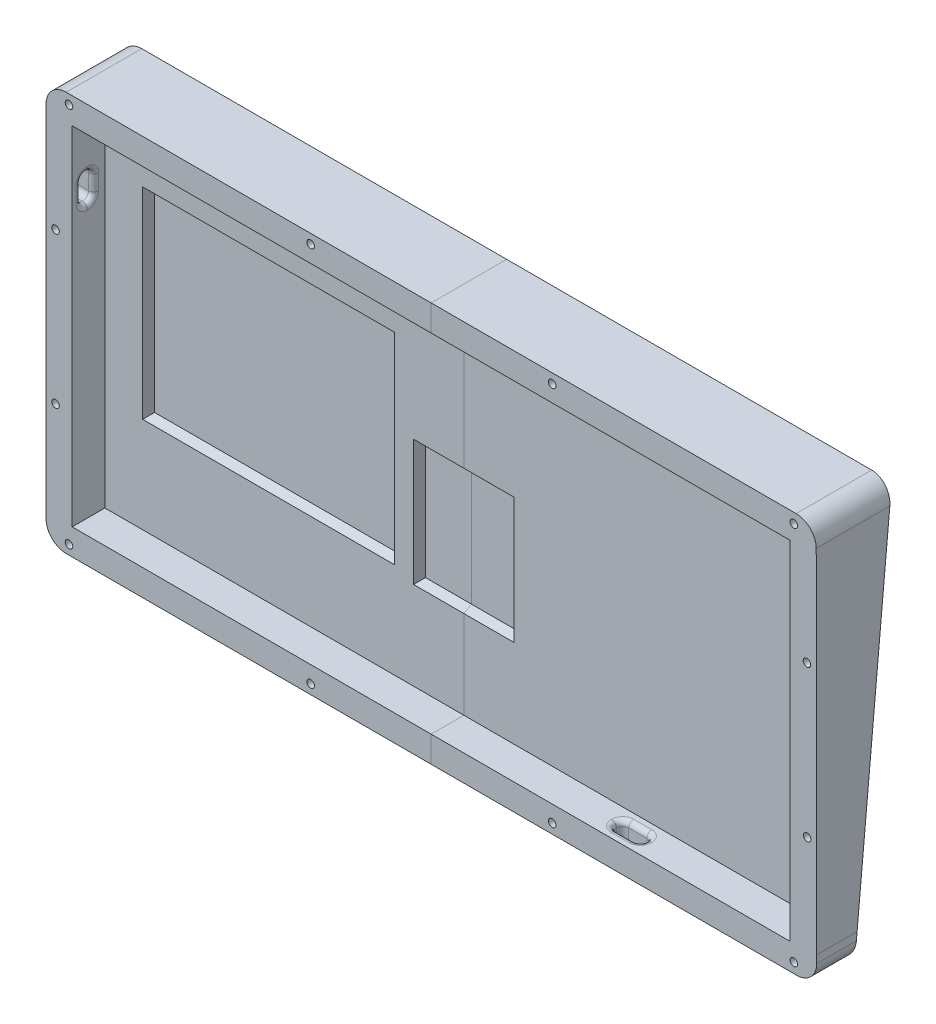
from build123d import *

# Parameters (mm, degrees)
EXTRUDE_1_DEPTH      = 30
SKETCH_2_R           = 1.5
CUT_EXTRUDE_1_DEPTH  = 5
CUT_EXTRUDE_4_DEPTH  = 307
SKETCH_3_W           = 285.26
SKETCH_3_H           = 138.01
CUT_EXTRUDE_5_DEPTH  = 13
SKETCH_12_W          = 40
SKETCH_12_H          = 50
CUT_EXTRUDE_7_DEPTH  = 3
CUT_EXTRUDE_7_DRAFT  = -30
SKETCH_9_W           = 100
SKETCH_9_H           = 80
CUT_EXTRUDE_8_DEPTH  = 3
CUT_EXTRUDE_8_DRAFT  = -30
CUT_EXTRUDE_9_DEPTH  = 11
FILLET_1_R           = 2
CUT_EXTRUDE_10_DEPTH = 11
FILLET_2_R           = 2
FILLET_3_R           = 2
FILLET_4_R           = 2


with BuildPart() as part:
    # Model → 凸台-拉伸1 (new body)
    with BuildSketch(Plane.XY):
        with BuildLine():
            Line((0, 11), (0, 150.75))
            ThreePointArc((0, 150.75), (2.343145751, 156.406854249), (8, 158.75))
            Line((8, 158.75), (298.011203897, 158.75))
            ThreePointArc((298.011203897, 158.75), (303.664092807, 156.410816811), (306.011196041, 150.761211743))
            Line((306.011196041, 150.761211743), (306.207051361, 11.011211743))
            Line((306.207051361, 11.011211743), (306.207051361, 8))
            ThreePointArc((306.207051361, 8), (303.863905611, 2.343145751), (298.207051361, 0))
            Line((298.207051361, 0), (8, 0))
            ThreePointArc((8, 0), (2.343145751, 2.343145751), (0, 8))
            Line((0, 8), (0, 11))
        make_face()
    extrude(amount=-EXTRUDE_1_DEPTH)

    # 草图2 → 切除-拉伸1 (cut)
    with BuildSketch(Plane.XY):
        with Locations((105.108569936, 3.75)):
            Circle(SKETCH_2_R)
        with Locations((9.108569936, 3.75)):
            Circle(SKETCH_2_R)
        with Locations((201.10846029, 3.817270412)):
            Circle(SKETCH_2_R)
        with Locations((297.108366012, 3.951811323)):
            Circle(SKETCH_2_R)
        with Locations((105.108569936, 155)):
            Circle(SKETCH_2_R)
        with Locations((9.108569936, 155)):
            Circle(SKETCH_2_R)
        with Locations((201.10846029, 154.932729588)):
            Circle(SKETCH_2_R)
        with Locations((297.108366012, 154.798188677)):
            Circle(SKETCH_2_R)
        with Locations((3.75, 109.375)):
            Circle(SKETCH_2_R)
        with Locations((3.75, 49.375)):
            Circle(SKETCH_2_R)
        with Locations((302.318900647, 109.584217456)):
            Circle(SKETCH_2_R)
        with Locations((302.402988717, 49.58427638)):
            Circle(SKETCH_2_R)
    extrude(amount=-CUT_EXTRUDE_1_DEPTH, mode=Mode.SUBTRACT)

    # 草图6 → 切除-拉伸4 (cut)
    with BuildSketch(Plane.ZY):
        Polygon((-30, 158.75), (-30, 0), (-15, 0), align=None)
    extrude(amount=-CUT_EXTRUDE_4_DEPTH, mode=Mode.SUBTRACT)

    # 草图3 → 切除-拉伸5 (cut)
    with BuildSketch(Plane.XY):
        with Locations((153, 79.375)):
            Rectangle(SKETCH_3_W, SKETCH_3_H)
    extrude(amount=-CUT_EXTRUDE_5_DEPTH, mode=Mode.SUBTRACT)


with BuildPart() as cut_extrude_7_tool:
    # 草图12 → 切除-拉伸7 (with draft: the straight prism first)
    with BuildSketch(Plane.XY.offset(-13)):
        with Locations((153, 70.37)):
            Rectangle(SKETCH_12_W, SKETCH_12_H)
    extrude(amount=-CUT_EXTRUDE_7_DEPTH)
    # 切除-拉伸7: the draft: its side faces are tilted about the plane it starts from
    cut_extrude_7_sides = [cut_extrude_7_tool.faces().sort_by_distance(p)[0] for p in [
        (153, 45.37, -14.5),
        (173, 70.37, -14.5),
        (153, 95.37, -14.5),
        (133, 70.37, -14.5),
    ]]
    draft(cut_extrude_7_sides, Plane.XY.offset(-13), CUT_EXTRUDE_7_DRAFT)


with BuildPart() as part_1:
    add(part.part)

    # 切除-拉伸7: cut by cut_extrude_7_tool
    add(cut_extrude_7_tool.part, mode=Mode.SUBTRACT)


with BuildPart() as cut_extrude_8_tool:
    # 草图9 → 切除-拉伸8 (with draft: the straight prism first)
    with BuildSketch(Plane.XY.offset(-13)):
        with Locations((75.37, 88.38)):
            Rectangle(SKETCH_9_W, SKETCH_9_H)
    extrude(amount=-CUT_EXTRUDE_8_DEPTH)
    # 切除-拉伸8: the draft: its side faces are tilted about the plane it starts from
    cut_extrude_8_sides = [cut_extrude_8_tool.faces().sort_by_distance(p)[0] for p in [
        (25.37, 88.38, -14.5),
        (75.37, 48.38, -14.5),
        (125.37, 88.38, -14.5),
        (75.37, 128.38, -14.5),
    ]]
    draft(cut_extrude_8_sides, Plane.XY.offset(-13), CUT_EXTRUDE_8_DRAFT)


with BuildPart() as part_2:
    add(part_1.part)

    # 切除-拉伸8: cut by cut_extrude_8_tool
    add(cut_extrude_8_tool.part, mode=Mode.SUBTRACT)

    # 草图14 → 切除-拉伸9 (cut)
    with BuildSketch(Plane.ZY):
        with BuildLine():
            Line((-5.9, 129.38), (-6.1, 129.38))
            ThreePointArc((-6.1, 129.38), (-7.797056275, 128.677056275), (-8.5, 126.98))
            Line((-8.5, 126.98), (-8.5, 120.78))
            ThreePointArc((-8.5, 120.78), (-7.797056275, 119.082943725), (-6.1, 118.38))
            Line((-6.1, 118.38), (-5.9, 118.38))
            ThreePointArc((-5.9, 118.38), (-4.202943725, 119.082943725), (-3.5, 120.78))
            Line((-3.5, 120.78), (-3.5, 126.98))
            ThreePointArc((-3.5, 126.98), (-4.202943725, 128.677056275), (-5.9, 129.38))
        make_face()
    extrude(amount=-CUT_EXTRUDE_9_DEPTH, mode=Mode.SUBTRACT)

    # 圆角1
    fillet_1_edges = [part_2.edges().sort_by_distance(p)[0] for p in [
        (0, 128.677056275, -7.797056275),
        (0, 129.38, -6),
        (0, 128.677056275, -4.202943725),
        (0, 123.88, -3.5),
        (0, 119.082943725, -4.202943725),
        (0, 118.38, -6),
        (0, 119.082943725, -7.797056275),
        (0, 123.88, -8.5),
    ]]
    fillet(fillet_1_edges, radius=FILLET_1_R)

    # 草图15 → 切除-拉伸10 (cut)
    with BuildSketch(Plane.XZ):
        with BuildLine():
            Line((222.53, -3.959687417), (229.73, -3.959687417))
            ThreePointArc((229.73, -3.959687417), (231.427056275, -4.662631142), (232.13, -6.359687417))
            Line((232.13, -6.359687417), (232.13, -6.559687417))
            ThreePointArc((232.13, -6.559687417), (231.427056275, -8.256743692), (229.73, -8.959687417))
            Line((229.73, -8.959687417), (222.53, -8.959687417))
            ThreePointArc((222.53, -8.959687417), (220.832943725, -8.256743692), (220.13, -6.559687417))
            Line((220.13, -6.559687417), (220.13, -6.359687417))
            ThreePointArc((220.13, -6.359687417), (220.832943725, -4.662631142), (222.53, -3.959687417))
        make_face()
    extrude(amount=-CUT_EXTRUDE_10_DEPTH, mode=Mode.SUBTRACT)

    # 圆角2
    fillet_2_edges = [part_2.edges().sort_by_distance(p)[0] for p in [
        (232.13, 0, -6.459687417),
        (231.427056275, 0, -4.662631142),
        (226.13, 0, -3.959687417),
        (220.832943725, 0, -4.662631142),
        (220.13, 0, -6.459687417),
        (220.832943725, 0, -8.256743692),
        (226.13, 0, -8.959687417),
        (231.427056275, 0, -8.256743692),
    ]]
    fillet(fillet_2_edges, radius=FILLET_2_R)

    # 圆角3
    fillet_3_edges = [part_2.edges().sort_by_distance(p)[0] for p in [
        (10.37, 129.38, -6),
        (10.37, 128.677056275, -4.202943725),
        (10.37, 123.88, -3.5),
        (10.37, 119.082943725, -4.202943725),
        (10.37, 118.38, -6),
        (10.37, 119.082943725, -7.797056275),
        (10.37, 123.88, -8.5),
        (10.37, 128.677056275, -7.797056275),
    ]]
    fillet(fillet_3_edges, radius=FILLET_3_R)

    # 圆角4
    fillet_4_edges = [part_2.edges().sort_by_distance(p)[0] for p in [
        (231.427056275, 10.37, -8.256743692),
        (232.13, 10.37, -6.459687417),
        (231.427056275, 10.37, -4.662631142),
        (226.13, 10.37, -3.959687417),
        (220.832943725, 10.37, -4.662631142),
        (220.13, 10.37, -6.459687417),
        (220.832943725, 10.37, -8.256743692),
        (226.13, 10.37, -8.959687417),
    ]]
    fillet(fillet_4_edges, radius=FILLET_4_R)


with BuildPart() as body_2:
    # Split Bodies 1: the piece on the far side of the plane
    add(part_2.part)
    split(bisect_by=Plane(origin=(153.005601949, 0, 0), x_dir=(0, 0, 1), z_dir=(1, 0, 0)), keep=Keep.BOTTOM)


with BuildPart() as part_3:
    add(part_2.part)

    # Split Bodies 1
    split(bisect_by=Plane(origin=(153.005601949, 0, 0), x_dir=(0, 0, 1), z_dir=(1, 0, 0)), keep=Keep.TOP)


solid = Compound([body_2.part, part_3.part])
